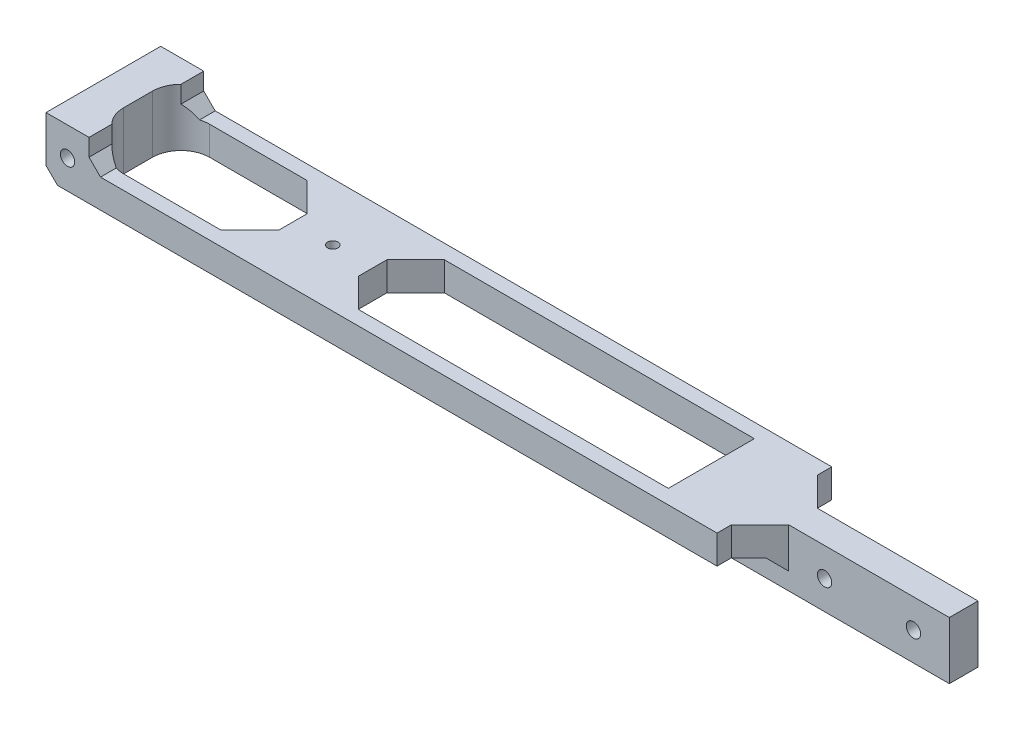
from build123d import *

# Parameters (mm, degrees)
SKETCH1_W           = 150
SKETCH1_H           = 20
SKETCH1_R           = 0.9
BOSS_EXTRUDE1_DEPTH = 5
SKETCH2_R           = 1.95
CUT_EXTRUDE1_DEPTH  = 2.9
SKETCH3_W           = 55.59541546
SKETCH3_H           = 20
BOSS_EXTRUDE2_DEPTH = 5
SKETCH7_W           = 20
SKETCH7_H           = 5
CUT_EXTRUDE3_DEPTH  = 27.6
SKETCH5_R           = 1.25
CUT_EXTRUDE4_DEPTH  = 27.6
SKETCH8_W           = 7.5
SKETCH8_H           = 20
BOSS_EXTRUDE3_DEPTH = 5
SKETCH9_R           = 1.25
CUT_EXTRUDE5_DEPTH  = 43
CHAMFER2_SIZE       = 2
CHAMFER3_SIZE       = 2
CHAMFER4_SIZE       = 5
SKETCH12_W          = 65.05458454
SKETCH12_H          = 15
SKETCH12_W_2        = 27.005472272
CUT_EXTRUDE33_DEPTH = 43
FILLET3_R           = 5
CHAMFER5_SIZE       = 5
CUT_EXTRUDE35_DEPTH = 34
SKETCH14_W          = 15
SKETCH14_H          = 5
BOSS_EXTRUDE4_DEPTH = 6
BOSS_EXTRUDE5_DEPTH = 18
CHAMFER7_SIZE       = 2
BOSS_EXTRUDE6_DEPTH = 1
CHAMFER8_SIZE       = 5


with BuildPart() as part:
    # Sketch1 → Boss-Extrude1 (new body)
    with BuildSketch(Plane(origin=(0, 0, 0), x_dir=(1, 0, 0), z_dir=(0, 1, 0))):
        with Locations((75, 10)):
            Rectangle(SKETCH1_W, SKETCH1_H)
        with Locations(Location((40, 10, 0), (0, 0, 270))):
            Circle(SKETCH1_R, mode=Mode.SUBTRACT)
    extrude(amount=BOSS_EXTRUDE1_DEPTH)

    # Sketch2 → Cut-Extrude1 (cut)
    with BuildSketch(Plane.XZ):
        with Locations(Location((40, -10, 0), (0, 0, 270))):
            Circle(SKETCH2_R)
    extrude(amount=-CUT_EXTRUDE1_DEPTH, mode=Mode.SUBTRACT)

    # Sketch3 → Boss-Extrude2 (add)
    with BuildSketch(Plane.XZ):
        with Locations((122.20229227, -10)):
            Rectangle(SKETCH3_W, SKETCH3_H)
    extrude(amount=BOSS_EXTRUDE2_DEPTH)

    # Sketch7 → Cut-Extrude3 (cut)
    with BuildSketch(Plane.ZY.offset(-94.40458454)):
        with Locations((-10, -2.5)):
            Rectangle(SKETCH7_W, SKETCH7_H)
    extrude(amount=-CUT_EXTRUDE3_DEPTH, mode=Mode.SUBTRACT)

    # Sketch5 → Cut-Extrude4 (cut)
    with BuildSketch(Plane(origin=(0, 0, -20), x_dir=(-1, 0, 0), z_dir=(0, 0, -1))):
        with Locations((-128.25, 0)):
            Circle(SKETCH5_R)
        with Locations((-143.75, 0)):
            Circle(SKETCH5_R)
    extrude(amount=-CUT_EXTRUDE4_DEPTH, mode=Mode.SUBTRACT)

    # Sketch8 → Boss-Extrude3 (add)
    with BuildSketch(Plane(origin=(0, 5, 0), x_dir=(1, 0, 0), z_dir=(0, 1, 0))):
        with Locations((3.75, 10)):
            Rectangle(SKETCH8_W, SKETCH8_H)
    extrude(amount=BOSS_EXTRUDE3_DEPTH)

    # Sketch9 → Cut-Extrude5 (cut)
    with BuildSketch(Plane(origin=(0, 0, -20), x_dir=(-1, 0, 0), z_dir=(0, 0, -1))):
        with Locations((-3.75, 5)):
            Circle(SKETCH9_R)
    extrude(amount=-CUT_EXTRUDE5_DEPTH, mode=Mode.SUBTRACT)

    # Chamfer2
    chamfer2_edges = [part.edges().sort_by_distance(p)[0] for p in [
        (7.5, 5, -10),
    ]]
    chamfer(chamfer2_edges, length=CHAMFER2_SIZE)

    # Chamfer3
    chamfer3_edges = [part.edges().sort_by_distance(p)[0] for p in [
        (0, 0, -10),
    ]]
    chamfer(chamfer3_edges, length=CHAMFER3_SIZE)

    # Chamfer4
    chamfer4_edges = [part.edges().sort_by_distance(p)[0] for p in [
        (122.00458454, 0, -10),
    ]]
    chamfer(chamfer4_edges, length=CHAMFER4_SIZE - 0.0001)  # a hair under: the kernel refuses the full size

    # Sketch12 → Cut-Extrude33 (cut)
    with BuildSketch(Plane.XZ):
        with Locations((79.47729227, -10)):
            Rectangle(SKETCH12_W, SKETCH12_H)
        with Locations((19.547263864, -10)):
            Rectangle(SKETCH12_W_2, SKETCH12_H)
    extrude(amount=-CUT_EXTRUDE33_DEPTH, mode=Mode.SUBTRACT)

    # Fillet3
    fillet3_edges = [part.edges().sort_by_distance(p)[0] for p in [
        (6.044527728, 5, -17.5),
        (6.044527728, 5, -2.5),
    ]]
    fillet(fillet3_edges, radius=FILLET3_R)

    # Chamfer5
    chamfer5_edges = [part.edges().sort_by_distance(p)[0] for p in [
        (46.95, 2.5, -17.5),
        (46.95, 2.5, -2.5),
        (33.05, 2.5, -2.5),
        (33.05, 2.5, -17.5),
    ]]
    chamfer(chamfer5_edges, length=CHAMFER5_SIZE)

    # Sketch13 → Cut-Extrude35 (cut)
    with BuildSketch(Plane(origin=(150, 0, 0), x_dir=(0, 0, -1), z_dir=(1, 0, 0))):
        Polygon((5, 5), (0, 5), (0, -5), (5, -5), (7.5, -5), (7.5, 5), align=None)
        Polygon((15, 5), (12.5, 5), (12.5, -5), (15, -5), (20, -5), (20, 5), align=None)
    extrude(amount=-CUT_EXTRUDE35_DEPTH, mode=Mode.SUBTRACT)

    # Sketch14 → Boss-Extrude4 (add)
    with BuildSketch(Plane.ZY.offset(-112.00458454)):
        with Locations((-10, 2.5)):
            Rectangle(SKETCH14_W, SKETCH14_H)
    extrude(amount=BOSS_EXTRUDE4_DEPTH)

    # Sketch15 → Boss-Extrude5 (add)
    with BuildSketch(Plane.ZY.offset(-106.00458454)):
        Polygon((-10, 5), (-7.5, 5), (-7.5, -5), (-12.5, -5), (-12.5, 5), align=None)
    extrude(amount=-BOSS_EXTRUDE5_DEPTH)

    # Chamfer7
    chamfer7_edges = [part.edges().sort_by_distance(p)[0] for p in [
        (106.00458454, -5, -10),
        (111.00229227, 0, -7.5),
        (111.00229227, 0, -12.5),
    ]]
    chamfer(chamfer7_edges, length=CHAMFER7_SIZE)

    # Sketch17 → Boss-Extrude6 (add)
    with BuildSketch(Plane(origin=(116, 0, 0), x_dir=(0, 0, -1), z_dir=(1, 0, 0))):
        Polygon((0, 0), (5.5, 0), (7.5, -2), (7.5, 5), (0, 5), align=None)
        Polygon((12.5, 5), (12.5, -2), (14.5, 0), (20, 0), (20, 5), align=None)
    extrude(amount=BOSS_EXTRUDE6_DEPTH)

    # Chamfer8
    chamfer8_edges = [part.edges().sort_by_distance(p)[0] for p in [
        (117, 1.5, -12.5),
        (117, 1.5, -7.5),
    ]]
    chamfer(chamfer8_edges, length=CHAMFER8_SIZE)


solid = part.part
